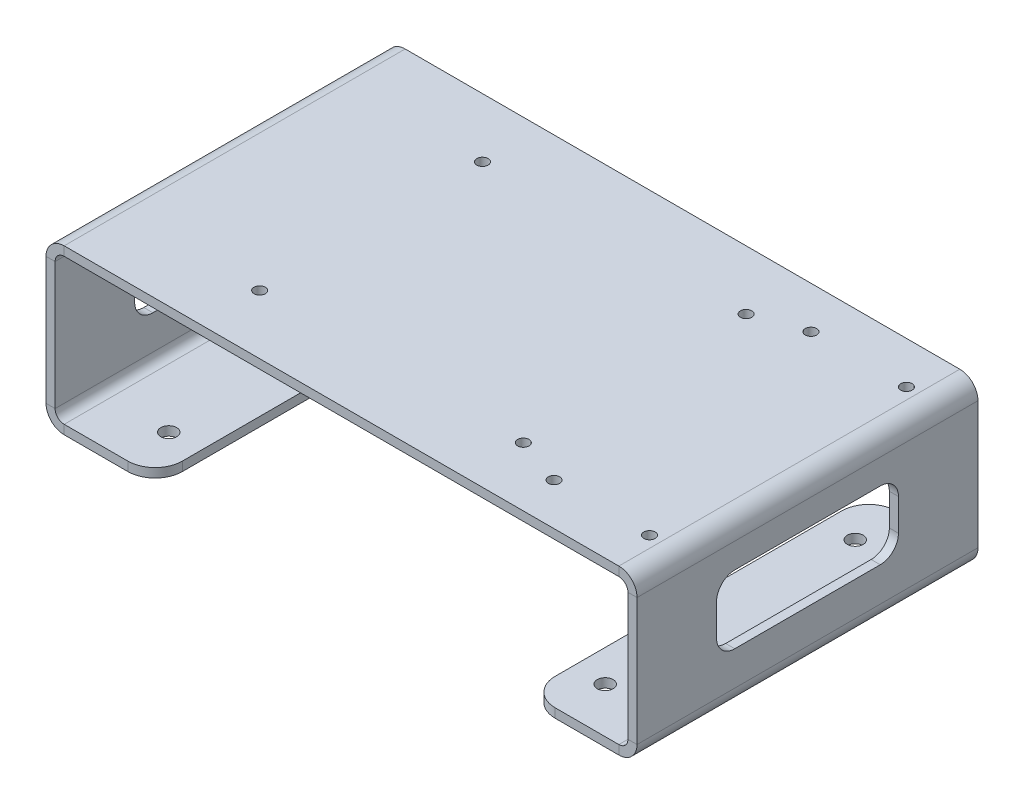
from build123d import *

# Parameters (mm, degrees)
SKETCH1_W                    = 130
SKETCH1_H                    = 75
BASE_FLANGE1_DEPTH           = 2
EDGE_FLANGE1_STRIP_W         = 12
EDGE_FLANGE1_STRIP_H         = 2
EDGE_FLANGE1_STRIP_CUT_DEPTH = 75
EDGE_FLANGE1_DEPTH           = 75
EDGE_FLANGE2_STRIP_W         = 12
EDGE_FLANGE2_STRIP_H         = 2
EDGE_FLANGE2_STRIP_CUT_DEPTH = 75
EDGE_FLANGE2_DEPTH           = 75
EDGE_FLANGE3_STRIP_W         = 12
EDGE_FLANGE3_STRIP_H         = 2
EDGE_FLANGE3_STRIP_CUT_DEPTH = 75
EDGE_FLANGE3_DEPTH           = 75
EDGE_FLANGE4_STRIP_W         = 12
EDGE_FLANGE4_STRIP_H         = 2
EDGE_FLANGE4_STRIP_CUT_DEPTH = 75
EDGE_FLANGE4_DEPTH           = 75
SKETCH20_R                   = 1.75
CUT_EXTRUDE1_DEPTH           = 2
CUT_EXTRUDE2_DEPTH           = 128
FILLET1_R                    = 6
SKETCH22_R                   = 1.25
CUT_EXTRUDE3_DEPTH           = 2
SKETCH23_R                   = 1.25
CUT_EXTRUDE4_DEPTH           = 2


# Sheet-metal steps are written as plain solids
with BuildPart() as part:
    # Sketch1 → Base-Flange1 (new body)
    with BuildSketch(Plane(origin=(0, 0, 0), x_dir=(1, 0, 0), z_dir=(0, 1, 0))):
        Rectangle(SKETCH1_W, SKETCH1_H)
    extrude(amount=-BASE_FLANGE1_DEPTH)

    # Edge-Flange1 strip (across the edge) → Edge-Flange1 strip cut (cut)
    with BuildSketch(Plane(origin=(-65, -2, 37.5), x_dir=(1, 0, 0), z_dir=(0, 0, -1))):
        with Locations((-2, -1)):
            Rectangle(EDGE_FLANGE1_STRIP_W, EDGE_FLANGE1_STRIP_H)
    extrude(amount=EDGE_FLANGE1_STRIP_CUT_DEPTH, mode=Mode.SUBTRACT)

    # Edge-Flange1 section (across the edge) → Edge-Flange1 (add)
    with BuildSketch(Plane(origin=(-65, -2, 37.5), x_dir=(1, 0, 0), z_dir=(0, 0, -1))):
        with BuildLine():
            Line((0, 2), (0, 32))
            Line((0, 32), (2, 32))
            Line((2, 32), (2, 2))
            ThreePointArc((2, 2), (2.585786438, 0.585786438), (4, 0))
            Line((4, 0), (4, -2))
            ThreePointArc((4, -2), (1.171572875, -0.828427125), (0, 2))
        make_face()
    extrude(amount=EDGE_FLANGE1_DEPTH)

    # Edge-Flange2 strip (across the edge) → Edge-Flange2 strip cut (cut)
    with BuildSketch(Plane(origin=(-63, -34, 37.5), x_dir=(0, 1, 0), z_dir=(0, 0, -1))):
        with Locations((-4, -1)):
            Rectangle(EDGE_FLANGE2_STRIP_W, EDGE_FLANGE2_STRIP_H)
    extrude(amount=EDGE_FLANGE2_STRIP_CUT_DEPTH, mode=Mode.SUBTRACT)

    # Edge-Flange2 section (across the edge) → Edge-Flange2 (add)
    with BuildSketch(Plane(origin=(-63, -34, 37.5), x_dir=(0, 1, 0), z_dir=(0, 0, -1))):
        with BuildLine():
            Line((-2, 2), (-2, 22))
            Line((-2, 22), (0, 22))
            Line((0, 22), (0, 2))
            ThreePointArc((0, 2), (0.585786438, 0.585786438), (2, 0))
            Line((2, 0), (2, -2))
            ThreePointArc((2, -2), (-0.828427125, -0.828427125), (-2, 2))
        make_face()
    extrude(amount=EDGE_FLANGE2_DEPTH)

    # Edge-Flange3 strip (across the edge) → Edge-Flange3 strip cut (cut)
    with BuildSketch(Plane(origin=(65, -2, -37.5), x_dir=(-1, 0, 0), z_dir=(0, 0, 1))):
        with Locations((-2, -1)):
            Rectangle(EDGE_FLANGE3_STRIP_W, EDGE_FLANGE3_STRIP_H)
    extrude(amount=EDGE_FLANGE3_STRIP_CUT_DEPTH, mode=Mode.SUBTRACT)

    # Edge-Flange3 section (across the edge) → Edge-Flange3 (add)
    with BuildSketch(Plane(origin=(65, -2, -37.5), x_dir=(-1, 0, 0), z_dir=(0, 0, 1))):
        with BuildLine():
            Line((0, 2), (0, 32))
            Line((0, 32), (2, 32))
            Line((2, 32), (2, 2))
            ThreePointArc((2, 2), (2.585786438, 0.585786438), (4, 0))
            Line((4, 0), (4, -2))
            ThreePointArc((4, -2), (1.171572875, -0.828427125), (0, 2))
        make_face()
    extrude(amount=EDGE_FLANGE3_DEPTH)

    # Edge-Flange4 strip (across the edge) → Edge-Flange4 strip cut (cut)
    with BuildSketch(Plane(origin=(63, -34, -37.5), x_dir=(0, 1, 0), z_dir=(0, 0, 1))):
        with Locations((-4, -1)):
            Rectangle(EDGE_FLANGE4_STRIP_W, EDGE_FLANGE4_STRIP_H)
    extrude(amount=EDGE_FLANGE4_STRIP_CUT_DEPTH, mode=Mode.SUBTRACT)

    # Edge-Flange4 section (across the edge) → Edge-Flange4 (add)
    with BuildSketch(Plane(origin=(63, -34, -37.5), x_dir=(0, 1, 0), z_dir=(0, 0, 1))):
        with BuildLine():
            Line((-2, 2), (-2, 22))
            Line((-2, 22), (0, 22))
            Line((0, 22), (0, 2))
            ThreePointArc((0, 2), (0.585786438, 0.585786438), (2, 0))
            Line((2, 0), (2, -2))
            ThreePointArc((2, -2), (-0.828427125, -0.828427125), (-2, 2))
        make_face()
    extrude(amount=EDGE_FLANGE4_DEPTH)

    # Sketch20 → Cut-Extrude1 (cut)
    with BuildSketch(Plane(origin=(0, -34, 0), x_dir=(1, 0, 0), z_dir=(0, 1, 0))):
        with Locations(Location((-48, -27.5, 0), (0, 0, 180))):
            Circle(SKETCH20_R)
        with Locations(Location((-48, 27.5, 0), (0, 0, 180))):
            Circle(SKETCH20_R)
    cut_extrude1 = extrude(amount=-CUT_EXTRUDE1_DEPTH, mode=Mode.SUBTRACT)

    # Sketch21 → Cut-Extrude2 (cut)
    with BuildSketch(Plane.ZY.offset(65)):
        with BuildLine():
            Line((-16, -9.5), (16, -9.5))
            ThreePointArc((16, -9.5), (18.828427125, -10.671572875), (20, -13.5))
            Line((20, -13.5), (20, -20.5))
            ThreePointArc((20, -20.5), (18.828427125, -23.328427125), (16, -24.5))
            Line((16, -24.5), (-16, -24.5))
            ThreePointArc((-16, -24.5), (-18.828427125, -23.328427125), (-20, -20.5))
            Line((-20, -20.5), (-20, -13.5))
            ThreePointArc((-20, -13.5), (-18.828427125, -10.671572875), (-16, -9.5))
        make_face()
    cut_extrude2 = extrude(amount=-CUT_EXTRUDE2_DEPTH, mode=Mode.SUBTRACT)

    # Fillet1
    fillet1_edges = [part.edges().sort_by_distance(p)[0] for p in [
        (41, -35, -37.5),
        (41, -35, 37.5),
        (-41, -35, 37.5),
        (-41, -35, -37.5),
    ]]
    fillet(fillet1_edges, radius=FILLET1_R)

    # Mirror4: Cut-Extrude1, Cut-Extrude2 across plane
    add(cut_extrude1.mirror(Plane(origin=(0, 0, 0), x_dir=(0, 0, 1), z_dir=(1, 0, 0))), mode=Mode.SUBTRACT)
    add(cut_extrude2.mirror(Plane(origin=(0, 0, 0), x_dir=(0, 0, 1), z_dir=(1, 0, 0))), mode=Mode.SUBTRACT)

    # Sketch22 → Cut-Extrude3 (cut)
    with BuildSketch(Plane(origin=(0, 0, 0), x_dir=(1, 0, 0), z_dir=(0, 1, 0))):
        with BuildLine():
            Line((-31, 23.25), (-31, 24.5))
            Line((-31, 24.5), (-29.75, 24.5))
            ThreePointArc((-29.75, 24.5), (-31.883883476, 25.383883476), (-31, 23.25))
        make_face()
        with BuildLine():
            Line((-29.75, 24.5), (-31, 24.5))
            Line((-31, 24.5), (-31, 23.25))
            ThreePointArc((-31, 23.25), (-30.116116524, 23.616116524), (-29.75, 24.5))
        make_face()
        with Locations(Location((27, 24.5, 0), (0, 0, 270))):
            Circle(SKETCH22_R)
        with Locations(Location((27, -24.5, 0), (0, 0, 270))):
            Circle(SKETCH22_R)
        with Locations(Location((-31, -24.5, 0), (0, 0, 270))):
            Circle(SKETCH22_R)
    extrude(amount=-CUT_EXTRUDE3_DEPTH, mode=Mode.SUBTRACT)

    # Sketch23 → Cut-Extrude4 (cut)
    with BuildSketch(Plane(origin=(0, 0, 0), x_dir=(1, 0, 0), z_dir=(0, 1, 0))):
        with BuildLine():
            ThreePointArc((38.75, -28.25), (38.383883476, -27.366116524), (37.5, -27))
            Line((37.5, -27), (37.5, -28.25))
            Line((37.5, -28.25), (38.75, -28.25))
        make_face()
        with BuildLine():
            Line((37.5, -28.25), (37.5, -27))
            ThreePointArc((37.5, -27), (36.616116524, -29.133883476), (38.75, -28.25))
            Line((38.75, -28.25), (37.5, -28.25))
        make_face()
        with Locations(Location((37.5, 28.25, 0), (0, 0, 270))):
            Circle(SKETCH23_R)
        with Locations(Location((58.5, 28.25, 0), (0, 0, 270))):
            Circle(SKETCH23_R)
        with Locations(Location((58.5, -28.25, 0), (0, 0, 270))):
            Circle(SKETCH23_R)
    extrude(amount=-CUT_EXTRUDE4_DEPTH, mode=Mode.SUBTRACT)


solid = part.part
